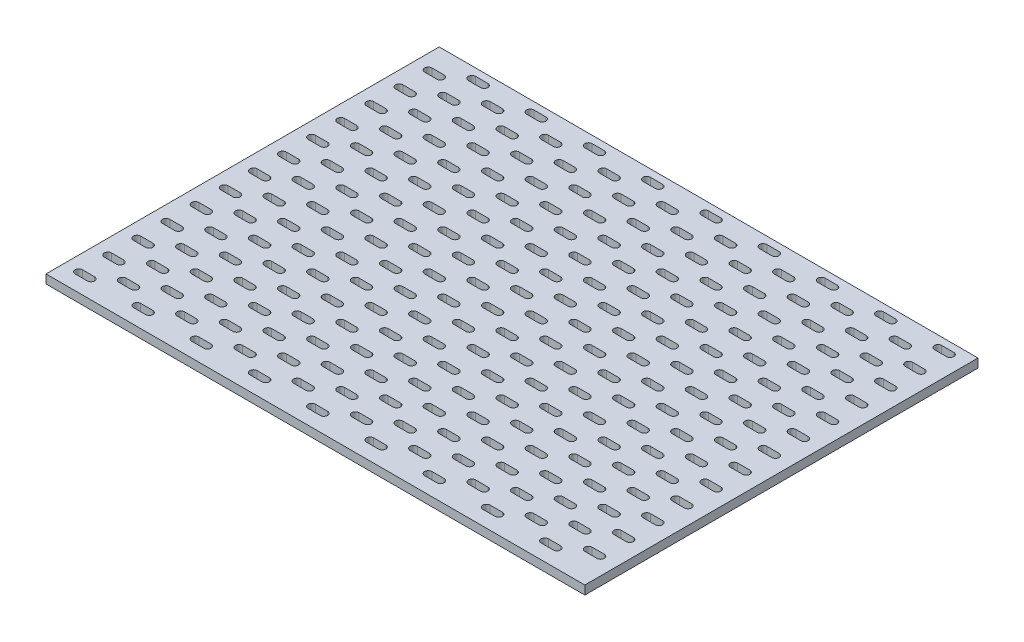
from build123d import *

# Parameters (mm, degrees)
SKETCH_1_W      = 370
SKETCH_1_H      = 270
EXTRUDE_1_DEPTH = 6


with BuildPart() as part:
    # Эскиз1 → Бобышка-Вытянуть1 (new body)
    with BuildSketch(Plane(origin=(0, 0, 0), x_dir=(1, 0, 0), z_dir=(0, 1, 0))):
        Rectangle(SKETCH_1_W, SKETCH_1_H)
        with BuildLine():
            Line((-155, 130), (-146.632466568, 130))
            ThreePointArc((-146.632466568, 130), (-144.132466568, 127.5), (-146.632466568, 125))
            Line((-146.632466568, 125), (-155, 125))
            ThreePointArc((-155, 125), (-157.5, 127.5), (-155, 130))
        make_face(mode=Mode.SUBTRACT)
        with BuildLine():
            Line((-175, 115), (-166.632466568, 115))
            ThreePointArc((-166.632466568, 115), (-164.132466568, 117.5), (-166.632466568, 120))
            Line((-166.632466568, 120), (-175, 120))
            ThreePointArc((-175, 120), (-177.5, 117.5), (-175, 115))
        make_face(mode=Mode.SUBTRACT)
        with BuildLine():
            Line((-115, 130), (-106.632466568, 130))
            ThreePointArc((-106.632466568, 130), (-104.132466568, 127.5), (-106.632466568, 125))
            Line((-106.632466568, 125), (-115, 125))
            ThreePointArc((-115, 125), (-117.5, 127.5), (-115, 130))
        make_face(mode=Mode.SUBTRACT)
        with BuildLine():
            Line((-135, 115), (-126.632466568, 115))
            ThreePointArc((-126.632466568, 115), (-124.132466568, 117.5), (-126.632466568, 120))
            Line((-126.632466568, 120), (-135, 120))
            ThreePointArc((-135, 120), (-137.5, 117.5), (-135, 115))
        make_face(mode=Mode.SUBTRACT)
        with BuildLine():
            Line((-75, 130), (-66.632466568, 130))
            ThreePointArc((-66.632466568, 130), (-64.132466568, 127.5), (-66.632466568, 125))
            Line((-66.632466568, 125), (-75, 125))
            ThreePointArc((-75, 125), (-77.5, 127.5), (-75, 130))
        make_face(mode=Mode.SUBTRACT)
        with BuildLine():
            Line((-95, 115), (-86.632466568, 115))
            ThreePointArc((-86.632466568, 115), (-84.132466568, 117.5), (-86.632466568, 120))
            Line((-86.632466568, 120), (-95, 120))
            ThreePointArc((-95, 120), (-97.5, 117.5), (-95, 115))
        make_face(mode=Mode.SUBTRACT)
        with BuildLine():
            Line((-35, 130), (-26.632466568, 130))
            ThreePointArc((-26.632466568, 130), (-24.132466568, 127.5), (-26.632466568, 125))
            Line((-26.632466568, 125), (-35, 125))
            ThreePointArc((-35, 125), (-37.5, 127.5), (-35, 130))
        make_face(mode=Mode.SUBTRACT)
        with BuildLine():
            Line((-55, 115), (-46.632466568, 115))
            ThreePointArc((-46.632466568, 115), (-44.132466568, 117.5), (-46.632466568, 120))
            Line((-46.632466568, 120), (-55, 120))
            ThreePointArc((-55, 120), (-57.5, 117.5), (-55, 115))
        make_face(mode=Mode.SUBTRACT)
        with BuildLine():
            Line((5, 130), (13.367533432, 130))
            ThreePointArc((13.367533432, 130), (15.867533432, 127.5), (13.367533432, 125))
            Line((13.367533432, 125), (5, 125))
            ThreePointArc((5, 125), (2.5, 127.5), (5, 130))
        make_face(mode=Mode.SUBTRACT)
        with BuildLine():
            Line((-15, 115), (-6.632466568, 115))
            ThreePointArc((-6.632466568, 115), (-4.132466568, 117.5), (-6.632466568, 120))
            Line((-6.632466568, 120), (-15, 120))
            ThreePointArc((-15, 120), (-17.5, 117.5), (-15, 115))
        make_face(mode=Mode.SUBTRACT)
        with BuildLine():
            Line((45, 130), (53.367533432, 130))
            ThreePointArc((53.367533432, 130), (55.867533432, 127.5), (53.367533432, 125))
            Line((53.367533432, 125), (45, 125))
            ThreePointArc((45, 125), (42.5, 127.5), (45, 130))
        make_face(mode=Mode.SUBTRACT)
        with BuildLine():
            Line((25, 115), (33.367533432, 115))
            ThreePointArc((33.367533432, 115), (35.867533432, 117.5), (33.367533432, 120))
            Line((33.367533432, 120), (25, 120))
            ThreePointArc((25, 120), (22.5, 117.5), (25, 115))
        make_face(mode=Mode.SUBTRACT)
        with BuildLine():
            Line((85, 130), (93.367533432, 130))
            ThreePointArc((93.367533432, 130), (95.867533432, 127.5), (93.367533432, 125))
            Line((93.367533432, 125), (85, 125))
            ThreePointArc((85, 125), (82.5, 127.5), (85, 130))
        make_face(mode=Mode.SUBTRACT)
        with BuildLine():
            Line((65, 115), (73.367533432, 115))
            ThreePointArc((73.367533432, 115), (75.867533432, 117.5), (73.367533432, 120))
            Line((73.367533432, 120), (65, 120))
            ThreePointArc((65, 120), (62.5, 117.5), (65, 115))
        make_face(mode=Mode.SUBTRACT)
        with BuildLine():
            Line((125, 130), (133.367533432, 130))
            ThreePointArc((133.367533432, 130), (135.867533432, 127.5), (133.367533432, 125))
            Line((133.367533432, 125), (125, 125))
            ThreePointArc((125, 125), (122.5, 127.5), (125, 130))
        make_face(mode=Mode.SUBTRACT)
        with BuildLine():
            Line((105, 115), (113.367533432, 115))
            ThreePointArc((113.367533432, 115), (115.867533432, 117.5), (113.367533432, 120))
            Line((113.367533432, 120), (105, 120))
            ThreePointArc((105, 120), (102.5, 117.5), (105, 115))
        make_face(mode=Mode.SUBTRACT)
        with BuildLine():
            Line((165, 130), (173.367533432, 130))
            ThreePointArc((173.367533432, 130), (175.867533432, 127.5), (173.367533432, 125))
            Line((173.367533432, 125), (165, 125))
            ThreePointArc((165, 125), (162.5, 127.5), (165, 130))
        make_face(mode=Mode.SUBTRACT)
        with BuildLine():
            Line((145, 115), (153.367533432, 115))
            ThreePointArc((153.367533432, 115), (155.867533432, 117.5), (153.367533432, 120))
            Line((153.367533432, 120), (145, 120))
            ThreePointArc((145, 120), (142.5, 117.5), (145, 115))
        make_face(mode=Mode.SUBTRACT)
        with BuildLine():
            Line((-155, 110), (-146.632466568, 110))
            ThreePointArc((-146.632466568, 110), (-144.132466568, 107.5), (-146.632466568, 105))
            Line((-146.632466568, 105), (-155, 105))
            ThreePointArc((-155, 105), (-157.5, 107.5), (-155, 110))
        make_face(mode=Mode.SUBTRACT)
        with BuildLine():
            Line((-175, 95), (-166.632466568, 95))
            ThreePointArc((-166.632466568, 95), (-164.132466568, 97.5), (-166.632466568, 100))
            Line((-166.632466568, 100), (-175, 100))
            ThreePointArc((-175, 100), (-177.5, 97.5), (-175, 95))
        make_face(mode=Mode.SUBTRACT)
        with BuildLine():
            Line((-115, 110), (-106.632466568, 110))
            ThreePointArc((-106.632466568, 110), (-104.132466568, 107.5), (-106.632466568, 105))
            Line((-106.632466568, 105), (-115, 105))
            ThreePointArc((-115, 105), (-117.5, 107.5), (-115, 110))
        make_face(mode=Mode.SUBTRACT)
        with BuildLine():
            Line((-135, 95), (-126.632466568, 95))
            ThreePointArc((-126.632466568, 95), (-124.132466568, 97.5), (-126.632466568, 100))
            Line((-126.632466568, 100), (-135, 100))
            ThreePointArc((-135, 100), (-137.5, 97.5), (-135, 95))
        make_face(mode=Mode.SUBTRACT)
        with BuildLine():
            Line((-75, 110), (-66.632466568, 110))
            ThreePointArc((-66.632466568, 110), (-64.132466568, 107.5), (-66.632466568, 105))
            Line((-66.632466568, 105), (-75, 105))
            ThreePointArc((-75, 105), (-77.5, 107.5), (-75, 110))
        make_face(mode=Mode.SUBTRACT)
        with BuildLine():
            Line((-95, 95), (-86.632466568, 95))
            ThreePointArc((-86.632466568, 95), (-84.132466568, 97.5), (-86.632466568, 100))
            Line((-86.632466568, 100), (-95, 100))
            ThreePointArc((-95, 100), (-97.5, 97.5), (-95, 95))
        make_face(mode=Mode.SUBTRACT)
        with BuildLine():
            Line((-35, 110), (-26.632466568, 110))
            ThreePointArc((-26.632466568, 110), (-24.132466568, 107.5), (-26.632466568, 105))
            Line((-26.632466568, 105), (-35, 105))
            ThreePointArc((-35, 105), (-37.5, 107.5), (-35, 110))
        make_face(mode=Mode.SUBTRACT)
        with BuildLine():
            Line((-55, 95), (-46.632466568, 95))
            ThreePointArc((-46.632466568, 95), (-44.132466568, 97.5), (-46.632466568, 100))
            Line((-46.632466568, 100), (-55, 100))
            ThreePointArc((-55, 100), (-57.5, 97.5), (-55, 95))
        make_face(mode=Mode.SUBTRACT)
        with BuildLine():
            Line((5, 110), (13.367533432, 110))
            ThreePointArc((13.367533432, 110), (15.867533432, 107.5), (13.367533432, 105))
            Line((13.367533432, 105), (5, 105))
            ThreePointArc((5, 105), (2.5, 107.5), (5, 110))
        make_face(mode=Mode.SUBTRACT)
        with BuildLine():
            Line((-15, 95), (-6.632466568, 95))
            ThreePointArc((-6.632466568, 95), (-4.132466568, 97.5), (-6.632466568, 100))
            Line((-6.632466568, 100), (-15, 100))
            ThreePointArc((-15, 100), (-17.5, 97.5), (-15, 95))
        make_face(mode=Mode.SUBTRACT)
        with BuildLine():
            Line((45, 110), (53.367533432, 110))
            ThreePointArc((53.367533432, 110), (55.867533432, 107.5), (53.367533432, 105))
            Line((53.367533432, 105), (45, 105))
            ThreePointArc((45, 105), (42.5, 107.5), (45, 110))
        make_face(mode=Mode.SUBTRACT)
        with BuildLine():
            Line((25, 95), (33.367533432, 95))
            ThreePointArc((33.367533432, 95), (35.867533432, 97.5), (33.367533432, 100))
            Line((33.367533432, 100), (25, 100))
            ThreePointArc((25, 100), (22.5, 97.5), (25, 95))
        make_face(mode=Mode.SUBTRACT)
        with BuildLine():
            Line((85, 110), (93.367533432, 110))
            ThreePointArc((93.367533432, 110), (95.867533432, 107.5), (93.367533432, 105))
            Line((93.367533432, 105), (85, 105))
            ThreePointArc((85, 105), (82.5, 107.5), (85, 110))
        make_face(mode=Mode.SUBTRACT)
        with BuildLine():
            Line((65, 95), (73.367533432, 95))
            ThreePointArc((73.367533432, 95), (75.867533432, 97.5), (73.367533432, 100))
            Line((73.367533432, 100), (65, 100))
            ThreePointArc((65, 100), (62.5, 97.5), (65, 95))
        make_face(mode=Mode.SUBTRACT)
        with BuildLine():
            Line((125, 110), (133.367533432, 110))
            ThreePointArc((133.367533432, 110), (135.867533432, 107.5), (133.367533432, 105))
            Line((133.367533432, 105), (125, 105))
            ThreePointArc((125, 105), (122.5, 107.5), (125, 110))
        make_face(mode=Mode.SUBTRACT)
        with BuildLine():
            Line((105, 95), (113.367533432, 95))
            ThreePointArc((113.367533432, 95), (115.867533432, 97.5), (113.367533432, 100))
            Line((113.367533432, 100), (105, 100))
            ThreePointArc((105, 100), (102.5, 97.5), (105, 95))
        make_face(mode=Mode.SUBTRACT)
        with BuildLine():
            Line((165, 110), (173.367533432, 110))
            ThreePointArc((173.367533432, 110), (175.867533432, 107.5), (173.367533432, 105))
            Line((173.367533432, 105), (165, 105))
            ThreePointArc((165, 105), (162.5, 107.5), (165, 110))
        make_face(mode=Mode.SUBTRACT)
        with BuildLine():
            Line((145, 95), (153.367533432, 95))
            ThreePointArc((153.367533432, 95), (155.867533432, 97.5), (153.367533432, 100))
            Line((153.367533432, 100), (145, 100))
            ThreePointArc((145, 100), (142.5, 97.5), (145, 95))
        make_face(mode=Mode.SUBTRACT)
        with BuildLine():
            Line((-155, 90), (-146.632466568, 90))
            ThreePointArc((-146.632466568, 90), (-144.132466568, 87.5), (-146.632466568, 85))
            Line((-146.632466568, 85), (-155, 85))
            ThreePointArc((-155, 85), (-157.5, 87.5), (-155, 90))
        make_face(mode=Mode.SUBTRACT)
        with BuildLine():
            Line((-175, 75), (-166.632466568, 75))
            ThreePointArc((-166.632466568, 75), (-164.132466568, 77.5), (-166.632466568, 80))
            Line((-166.632466568, 80), (-175, 80))
            ThreePointArc((-175, 80), (-177.5, 77.5), (-175, 75))
        make_face(mode=Mode.SUBTRACT)
        with BuildLine():
            Line((-115, 90), (-106.632466568, 90))
            ThreePointArc((-106.632466568, 90), (-104.132466568, 87.5), (-106.632466568, 85))
            Line((-106.632466568, 85), (-115, 85))
            ThreePointArc((-115, 85), (-117.5, 87.5), (-115, 90))
        make_face(mode=Mode.SUBTRACT)
        with BuildLine():
            Line((-135, 75), (-126.632466568, 75))
            ThreePointArc((-126.632466568, 75), (-124.132466568, 77.5), (-126.632466568, 80))
            Line((-126.632466568, 80), (-135, 80))
            ThreePointArc((-135, 80), (-137.5, 77.5), (-135, 75))
        make_face(mode=Mode.SUBTRACT)
        with BuildLine():
            Line((-75, 90), (-66.632466568, 90))
            ThreePointArc((-66.632466568, 90), (-64.132466568, 87.5), (-66.632466568, 85))
            Line((-66.632466568, 85), (-75, 85))
            ThreePointArc((-75, 85), (-77.5, 87.5), (-75, 90))
        make_face(mode=Mode.SUBTRACT)
        with BuildLine():
            Line((-95, 75), (-86.632466568, 75))
            ThreePointArc((-86.632466568, 75), (-84.132466568, 77.5), (-86.632466568, 80))
            Line((-86.632466568, 80), (-95, 80))
            ThreePointArc((-95, 80), (-97.5, 77.5), (-95, 75))
        make_face(mode=Mode.SUBTRACT)
        with BuildLine():
            Line((-35, 90), (-26.632466568, 90))
            ThreePointArc((-26.632466568, 90), (-24.132466568, 87.5), (-26.632466568, 85))
            Line((-26.632466568, 85), (-35, 85))
            ThreePointArc((-35, 85), (-37.5, 87.5), (-35, 90))
        make_face(mode=Mode.SUBTRACT)
        with BuildLine():
            Line((-55, 75), (-46.632466568, 75))
            ThreePointArc((-46.632466568, 75), (-44.132466568, 77.5), (-46.632466568, 80))
            Line((-46.632466568, 80), (-55, 80))
            ThreePointArc((-55, 80), (-57.5, 77.5), (-55, 75))
        make_face(mode=Mode.SUBTRACT)
        with BuildLine():
            Line((5, 90), (13.367533432, 90))
            ThreePointArc((13.367533432, 90), (15.867533432, 87.5), (13.367533432, 85))
            Line((13.367533432, 85), (5, 85))
            ThreePointArc((5, 85), (2.5, 87.5), (5, 90))
        make_face(mode=Mode.SUBTRACT)
        with BuildLine():
            Line((-15, 75), (-6.632466568, 75))
            ThreePointArc((-6.632466568, 75), (-4.132466568, 77.5), (-6.632466568, 80))
            Line((-6.632466568, 80), (-15, 80))
            ThreePointArc((-15, 80), (-17.5, 77.5), (-15, 75))
        make_face(mode=Mode.SUBTRACT)
        with BuildLine():
            Line((45, 90), (53.367533432, 90))
            ThreePointArc((53.367533432, 90), (55.867533432, 87.5), (53.367533432, 85))
            Line((53.367533432, 85), (45, 85))
            ThreePointArc((45, 85), (42.5, 87.5), (45, 90))
        make_face(mode=Mode.SUBTRACT)
        with BuildLine():
            Line((25, 75), (33.367533432, 75))
            ThreePointArc((33.367533432, 75), (35.867533432, 77.5), (33.367533432, 80))
            Line((33.367533432, 80), (25, 80))
            ThreePointArc((25, 80), (22.5, 77.5), (25, 75))
        make_face(mode=Mode.SUBTRACT)
        with BuildLine():
            Line((85, 90), (93.367533432, 90))
            ThreePointArc((93.367533432, 90), (95.867533432, 87.5), (93.367533432, 85))
            Line((93.367533432, 85), (85, 85))
            ThreePointArc((85, 85), (82.5, 87.5), (85, 90))
        make_face(mode=Mode.SUBTRACT)
        with BuildLine():
            Line((65, 75), (73.367533432, 75))
            ThreePointArc((73.367533432, 75), (75.867533432, 77.5), (73.367533432, 80))
            Line((73.367533432, 80), (65, 80))
            ThreePointArc((65, 80), (62.5, 77.5), (65, 75))
        make_face(mode=Mode.SUBTRACT)
        with BuildLine():
            Line((125, 90), (133.367533432, 90))
            ThreePointArc((133.367533432, 90), (135.867533432, 87.5), (133.367533432, 85))
            Line((133.367533432, 85), (125, 85))
            ThreePointArc((125, 85), (122.5, 87.5), (125, 90))
        make_face(mode=Mode.SUBTRACT)
        with BuildLine():
            Line((105, 75), (113.367533432, 75))
            ThreePointArc((113.367533432, 75), (115.867533432, 77.5), (113.367533432, 80))
            Line((113.367533432, 80), (105, 80))
            ThreePointArc((105, 80), (102.5, 77.5), (105, 75))
        make_face(mode=Mode.SUBTRACT)
        with BuildLine():
            Line((165, 90), (173.367533432, 90))
            ThreePointArc((173.367533432, 90), (175.867533432, 87.5), (173.367533432, 85))
            Line((173.367533432, 85), (165, 85))
            ThreePointArc((165, 85), (162.5, 87.5), (165, 90))
        make_face(mode=Mode.SUBTRACT)
        with BuildLine():
            Line((145, 75), (153.367533432, 75))
            ThreePointArc((153.367533432, 75), (155.867533432, 77.5), (153.367533432, 80))
            Line((153.367533432, 80), (145, 80))
            ThreePointArc((145, 80), (142.5, 77.5), (145, 75))
        make_face(mode=Mode.SUBTRACT)
        with BuildLine():
            Line((-155, 70), (-146.632466568, 70))
            ThreePointArc((-146.632466568, 70), (-144.132466568, 67.5), (-146.632466568, 65))
            Line((-146.632466568, 65), (-155, 65))
            ThreePointArc((-155, 65), (-157.5, 67.5), (-155, 70))
        make_face(mode=Mode.SUBTRACT)
        with BuildLine():
            Line((-175, 55), (-166.632466568, 55))
            ThreePointArc((-166.632466568, 55), (-164.132466568, 57.5), (-166.632466568, 60))
            Line((-166.632466568, 60), (-175, 60))
            ThreePointArc((-175, 60), (-177.5, 57.5), (-175, 55))
        make_face(mode=Mode.SUBTRACT)
        with BuildLine():
            Line((-115, 70), (-106.632466568, 70))
            ThreePointArc((-106.632466568, 70), (-104.132466568, 67.5), (-106.632466568, 65))
            Line((-106.632466568, 65), (-115, 65))
            ThreePointArc((-115, 65), (-117.5, 67.5), (-115, 70))
        make_face(mode=Mode.SUBTRACT)
        with BuildLine():
            Line((-135, 55), (-126.632466568, 55))
            ThreePointArc((-126.632466568, 55), (-124.132466568, 57.5), (-126.632466568, 60))
            Line((-126.632466568, 60), (-135, 60))
            ThreePointArc((-135, 60), (-137.5, 57.5), (-135, 55))
        make_face(mode=Mode.SUBTRACT)
        with BuildLine():
            Line((-75, 70), (-66.632466568, 70))
            ThreePointArc((-66.632466568, 70), (-64.132466568, 67.5), (-66.632466568, 65))
            Line((-66.632466568, 65), (-75, 65))
            ThreePointArc((-75, 65), (-77.5, 67.5), (-75, 70))
        make_face(mode=Mode.SUBTRACT)
        with BuildLine():
            Line((-95, 55), (-86.632466568, 55))
            ThreePointArc((-86.632466568, 55), (-84.132466568, 57.5), (-86.632466568, 60))
            Line((-86.632466568, 60), (-95, 60))
            ThreePointArc((-95, 60), (-97.5, 57.5), (-95, 55))
        make_face(mode=Mode.SUBTRACT)
        with BuildLine():
            Line((-35, 70), (-26.632466568, 70))
            ThreePointArc((-26.632466568, 70), (-24.132466568, 67.5), (-26.632466568, 65))
            Line((-26.632466568, 65), (-35, 65))
            ThreePointArc((-35, 65), (-37.5, 67.5), (-35, 70))
        make_face(mode=Mode.SUBTRACT)
        with BuildLine():
            Line((-55, 55), (-46.632466568, 55))
            ThreePointArc((-46.632466568, 55), (-44.132466568, 57.5), (-46.632466568, 60))
            Line((-46.632466568, 60), (-55, 60))
            ThreePointArc((-55, 60), (-57.5, 57.5), (-55, 55))
        make_face(mode=Mode.SUBTRACT)
        with BuildLine():
            Line((5, 70), (13.367533432, 70))
            ThreePointArc((13.367533432, 70), (15.867533432, 67.5), (13.367533432, 65))
            Line((13.367533432, 65), (5, 65))
            ThreePointArc((5, 65), (2.5, 67.5), (5, 70))
        make_face(mode=Mode.SUBTRACT)
        with BuildLine():
            Line((-15, 55), (-6.632466568, 55))
            ThreePointArc((-6.632466568, 55), (-4.132466568, 57.5), (-6.632466568, 60))
            Line((-6.632466568, 60), (-15, 60))
            ThreePointArc((-15, 60), (-17.5, 57.5), (-15, 55))
        make_face(mode=Mode.SUBTRACT)
        with BuildLine():
            Line((45, 70), (53.367533432, 70))
            ThreePointArc((53.367533432, 70), (55.867533432, 67.5), (53.367533432, 65))
            Line((53.367533432, 65), (45, 65))
            ThreePointArc((45, 65), (42.5, 67.5), (45, 70))
        make_face(mode=Mode.SUBTRACT)
        with BuildLine():
            Line((25, 55), (33.367533432, 55))
            ThreePointArc((33.367533432, 55), (35.867533432, 57.5), (33.367533432, 60))
            Line((33.367533432, 60), (25, 60))
            ThreePointArc((25, 60), (22.5, 57.5), (25, 55))
        make_face(mode=Mode.SUBTRACT)
        with BuildLine():
            Line((85, 70), (93.367533432, 70))
            ThreePointArc((93.367533432, 70), (95.867533432, 67.5), (93.367533432, 65))
            Line((93.367533432, 65), (85, 65))
            ThreePointArc((85, 65), (82.5, 67.5), (85, 70))
        make_face(mode=Mode.SUBTRACT)
        with BuildLine():
            Line((65, 55), (73.367533432, 55))
            ThreePointArc((73.367533432, 55), (75.867533432, 57.5), (73.367533432, 60))
            Line((73.367533432, 60), (65, 60))
            ThreePointArc((65, 60), (62.5, 57.5), (65, 55))
        make_face(mode=Mode.SUBTRACT)
        with BuildLine():
            Line((125, 70), (133.367533432, 70))
            ThreePointArc((133.367533432, 70), (135.867533432, 67.5), (133.367533432, 65))
            Line((133.367533432, 65), (125, 65))
            ThreePointArc((125, 65), (122.5, 67.5), (125, 70))
        make_face(mode=Mode.SUBTRACT)
        with BuildLine():
            Line((105, 55), (113.367533432, 55))
            ThreePointArc((113.367533432, 55), (115.867533432, 57.5), (113.367533432, 60))
            Line((113.367533432, 60), (105, 60))
            ThreePointArc((105, 60), (102.5, 57.5), (105, 55))
        make_face(mode=Mode.SUBTRACT)
        with BuildLine():
            Line((165, 70), (173.367533432, 70))
            ThreePointArc((173.367533432, 70), (175.867533432, 67.5), (173.367533432, 65))
            Line((173.367533432, 65), (165, 65))
            ThreePointArc((165, 65), (162.5, 67.5), (165, 70))
        make_face(mode=Mode.SUBTRACT)
        with BuildLine():
            Line((145, 55), (153.367533432, 55))
            ThreePointArc((153.367533432, 55), (155.867533432, 57.5), (153.367533432, 60))
            Line((153.367533432, 60), (145, 60))
            ThreePointArc((145, 60), (142.5, 57.5), (145, 55))
        make_face(mode=Mode.SUBTRACT)
        with BuildLine():
            Line((-155, 50), (-146.632466568, 50))
            ThreePointArc((-146.632466568, 50), (-144.132466568, 47.5), (-146.632466568, 45))
            Line((-146.632466568, 45), (-155, 45))
            ThreePointArc((-155, 45), (-157.5, 47.5), (-155, 50))
        make_face(mode=Mode.SUBTRACT)
        with BuildLine():
            Line((-175, 35), (-166.632466568, 35))
            ThreePointArc((-166.632466568, 35), (-164.132466568, 37.5), (-166.632466568, 40))
            Line((-166.632466568, 40), (-175, 40))
            ThreePointArc((-175, 40), (-177.5, 37.5), (-175, 35))
        make_face(mode=Mode.SUBTRACT)
        with BuildLine():
            Line((-115, 50), (-106.632466568, 50))
            ThreePointArc((-106.632466568, 50), (-104.132466568, 47.5), (-106.632466568, 45))
            Line((-106.632466568, 45), (-115, 45))
            ThreePointArc((-115, 45), (-117.5, 47.5), (-115, 50))
        make_face(mode=Mode.SUBTRACT)
        with BuildLine():
            Line((-135, 35), (-126.632466568, 35))
            ThreePointArc((-126.632466568, 35), (-124.132466568, 37.5), (-126.632466568, 40))
            Line((-126.632466568, 40), (-135, 40))
            ThreePointArc((-135, 40), (-137.5, 37.5), (-135, 35))
        make_face(mode=Mode.SUBTRACT)
        with BuildLine():
            Line((-75, 50), (-66.632466568, 50))
            ThreePointArc((-66.632466568, 50), (-64.132466568, 47.5), (-66.632466568, 45))
            Line((-66.632466568, 45), (-75, 45))
            ThreePointArc((-75, 45), (-77.5, 47.5), (-75, 50))
        make_face(mode=Mode.SUBTRACT)
        with BuildLine():
            Line((-95, 35), (-86.632466568, 35))
            ThreePointArc((-86.632466568, 35), (-84.132466568, 37.5), (-86.632466568, 40))
            Line((-86.632466568, 40), (-95, 40))
            ThreePointArc((-95, 40), (-97.5, 37.5), (-95, 35))
        make_face(mode=Mode.SUBTRACT)
        with BuildLine():
            Line((-35, 50), (-26.632466568, 50))
            ThreePointArc((-26.632466568, 50), (-24.132466568, 47.5), (-26.632466568, 45))
            Line((-26.632466568, 45), (-35, 45))
            ThreePointArc((-35, 45), (-37.5, 47.5), (-35, 50))
        make_face(mode=Mode.SUBTRACT)
        with BuildLine():
            Line((-55, 35), (-46.632466568, 35))
            ThreePointArc((-46.632466568, 35), (-44.132466568, 37.5), (-46.632466568, 40))
            Line((-46.632466568, 40), (-55, 40))
            ThreePointArc((-55, 40), (-57.5, 37.5), (-55, 35))
        make_face(mode=Mode.SUBTRACT)
        with BuildLine():
            Line((5, 50), (13.367533432, 50))
            ThreePointArc((13.367533432, 50), (15.867533432, 47.5), (13.367533432, 45))
            Line((13.367533432, 45), (5, 45))
            ThreePointArc((5, 45), (2.5, 47.5), (5, 50))
        make_face(mode=Mode.SUBTRACT)
        with BuildLine():
            Line((-15, 35), (-6.632466568, 35))
            ThreePointArc((-6.632466568, 35), (-4.132466568, 37.5), (-6.632466568, 40))
            Line((-6.632466568, 40), (-15, 40))
            ThreePointArc((-15, 40), (-17.5, 37.5), (-15, 35))
        make_face(mode=Mode.SUBTRACT)
        with BuildLine():
            Line((45, 50), (53.367533432, 50))
            ThreePointArc((53.367533432, 50), (55.867533432, 47.5), (53.367533432, 45))
            Line((53.367533432, 45), (45, 45))
            ThreePointArc((45, 45), (42.5, 47.5), (45, 50))
        make_face(mode=Mode.SUBTRACT)
        with BuildLine():
            Line((25, 35), (33.367533432, 35))
            ThreePointArc((33.367533432, 35), (35.867533432, 37.5), (33.367533432, 40))
            Line((33.367533432, 40), (25, 40))
            ThreePointArc((25, 40), (22.5, 37.5), (25, 35))
        make_face(mode=Mode.SUBTRACT)
        with BuildLine():
            Line((85, 50), (93.367533432, 50))
            ThreePointArc((93.367533432, 50), (95.867533432, 47.5), (93.367533432, 45))
            Line((93.367533432, 45), (85, 45))
            ThreePointArc((85, 45), (82.5, 47.5), (85, 50))
        make_face(mode=Mode.SUBTRACT)
        with BuildLine():
            Line((65, 35), (73.367533432, 35))
            ThreePointArc((73.367533432, 35), (75.867533432, 37.5), (73.367533432, 40))
            Line((73.367533432, 40), (65, 40))
            ThreePointArc((65, 40), (62.5, 37.5), (65, 35))
        make_face(mode=Mode.SUBTRACT)
        with BuildLine():
            Line((125, 50), (133.367533432, 50))
            ThreePointArc((133.367533432, 50), (135.867533432, 47.5), (133.367533432, 45))
            Line((133.367533432, 45), (125, 45))
            ThreePointArc((125, 45), (122.5, 47.5), (125, 50))
        make_face(mode=Mode.SUBTRACT)
        with BuildLine():
            Line((105, 35), (113.367533432, 35))
            ThreePointArc((113.367533432, 35), (115.867533432, 37.5), (113.367533432, 40))
            Line((113.367533432, 40), (105, 40))
            ThreePointArc((105, 40), (102.5, 37.5), (105, 35))
        make_face(mode=Mode.SUBTRACT)
        with BuildLine():
            Line((165, 50), (173.367533432, 50))
            ThreePointArc((173.367533432, 50), (175.867533432, 47.5), (173.367533432, 45))
            Line((173.367533432, 45), (165, 45))
            ThreePointArc((165, 45), (162.5, 47.5), (165, 50))
        make_face(mode=Mode.SUBTRACT)
        with BuildLine():
            Line((145, 35), (153.367533432, 35))
            ThreePointArc((153.367533432, 35), (155.867533432, 37.5), (153.367533432, 40))
            Line((153.367533432, 40), (145, 40))
            ThreePointArc((145, 40), (142.5, 37.5), (145, 35))
        make_face(mode=Mode.SUBTRACT)
        with BuildLine():
            Line((-155, 30), (-146.632466568, 30))
            ThreePointArc((-146.632466568, 30), (-144.132466568, 27.5), (-146.632466568, 25))
            Line((-146.632466568, 25), (-155, 25))
            ThreePointArc((-155, 25), (-157.5, 27.5), (-155, 30))
        make_face(mode=Mode.SUBTRACT)
        with BuildLine():
            Line((-175, 15), (-166.632466568, 15))
            ThreePointArc((-166.632466568, 15), (-164.132466568, 17.5), (-166.632466568, 20))
            Line((-166.632466568, 20), (-175, 20))
            ThreePointArc((-175, 20), (-177.5, 17.5), (-175, 15))
        make_face(mode=Mode.SUBTRACT)
        with BuildLine():
            Line((-115, 30), (-106.632466568, 30))
            ThreePointArc((-106.632466568, 30), (-104.132466568, 27.5), (-106.632466568, 25))
            Line((-106.632466568, 25), (-115, 25))
            ThreePointArc((-115, 25), (-117.5, 27.5), (-115, 30))
        make_face(mode=Mode.SUBTRACT)
        with BuildLine():
            Line((-135, 15), (-126.632466568, 15))
            ThreePointArc((-126.632466568, 15), (-124.132466568, 17.5), (-126.632466568, 20))
            Line((-126.632466568, 20), (-135, 20))
            ThreePointArc((-135, 20), (-137.5, 17.5), (-135, 15))
        make_face(mode=Mode.SUBTRACT)
        with BuildLine():
            Line((-75, 30), (-66.632466568, 30))
            ThreePointArc((-66.632466568, 30), (-64.132466568, 27.5), (-66.632466568, 25))
            Line((-66.632466568, 25), (-75, 25))
            ThreePointArc((-75, 25), (-77.5, 27.5), (-75, 30))
        make_face(mode=Mode.SUBTRACT)
        with BuildLine():
            Line((-95, 15), (-86.632466568, 15))
            ThreePointArc((-86.632466568, 15), (-84.132466568, 17.5), (-86.632466568, 20))
            Line((-86.632466568, 20), (-95, 20))
            ThreePointArc((-95, 20), (-97.5, 17.5), (-95, 15))
        make_face(mode=Mode.SUBTRACT)
        with BuildLine():
            Line((-35, 30), (-26.632466568, 30))
            ThreePointArc((-26.632466568, 30), (-24.132466568, 27.5), (-26.632466568, 25))
            Line((-26.632466568, 25), (-35, 25))
            ThreePointArc((-35, 25), (-37.5, 27.5), (-35, 30))
        make_face(mode=Mode.SUBTRACT)
        with BuildLine():
            Line((-55, 15), (-46.632466568, 15))
            ThreePointArc((-46.632466568, 15), (-44.132466568, 17.5), (-46.632466568, 20))
            Line((-46.632466568, 20), (-55, 20))
            ThreePointArc((-55, 20), (-57.5, 17.5), (-55, 15))
        make_face(mode=Mode.SUBTRACT)
        with BuildLine():
            Line((5, 30), (13.367533432, 30))
            ThreePointArc((13.367533432, 30), (15.867533432, 27.5), (13.367533432, 25))
            Line((13.367533432, 25), (5, 25))
            ThreePointArc((5, 25), (2.5, 27.5), (5, 30))
        make_face(mode=Mode.SUBTRACT)
        with BuildLine():
            Line((-15, 15), (-6.632466568, 15))
            ThreePointArc((-6.632466568, 15), (-4.132466568, 17.5), (-6.632466568, 20))
            Line((-6.632466568, 20), (-15, 20))
            ThreePointArc((-15, 20), (-17.5, 17.5), (-15, 15))
        make_face(mode=Mode.SUBTRACT)
        with BuildLine():
            Line((45, 30), (53.367533432, 30))
            ThreePointArc((53.367533432, 30), (55.867533432, 27.5), (53.367533432, 25))
            Line((53.367533432, 25), (45, 25))
            ThreePointArc((45, 25), (42.5, 27.5), (45, 30))
        make_face(mode=Mode.SUBTRACT)
        with BuildLine():
            Line((25, 15), (33.367533432, 15))
            ThreePointArc((33.367533432, 15), (35.867533432, 17.5), (33.367533432, 20))
            Line((33.367533432, 20), (25, 20))
            ThreePointArc((25, 20), (22.5, 17.5), (25, 15))
        make_face(mode=Mode.SUBTRACT)
        with BuildLine():
            Line((85, 30), (93.367533432, 30))
            ThreePointArc((93.367533432, 30), (95.867533432, 27.5), (93.367533432, 25))
            Line((93.367533432, 25), (85, 25))
            ThreePointArc((85, 25), (82.5, 27.5), (85, 30))
        make_face(mode=Mode.SUBTRACT)
        with BuildLine():
            Line((65, 15), (73.367533432, 15))
            ThreePointArc((73.367533432, 15), (75.867533432, 17.5), (73.367533432, 20))
            Line((73.367533432, 20), (65, 20))
            ThreePointArc((65, 20), (62.5, 17.5), (65, 15))
        make_face(mode=Mode.SUBTRACT)
        with BuildLine():
            Line((125, 30), (133.367533432, 30))
            ThreePointArc((133.367533432, 30), (135.867533432, 27.5), (133.367533432, 25))
            Line((133.367533432, 25), (125, 25))
            ThreePointArc((125, 25), (122.5, 27.5), (125, 30))
        make_face(mode=Mode.SUBTRACT)
        with BuildLine():
            Line((105, 15), (113.367533432, 15))
            ThreePointArc((113.367533432, 15), (115.867533432, 17.5), (113.367533432, 20))
            Line((113.367533432, 20), (105, 20))
            ThreePointArc((105, 20), (102.5, 17.5), (105, 15))
        make_face(mode=Mode.SUBTRACT)
        with BuildLine():
            Line((165, 30), (173.367533432, 30))
            ThreePointArc((173.367533432, 30), (175.867533432, 27.5), (173.367533432, 25))
            Line((173.367533432, 25), (165, 25))
            ThreePointArc((165, 25), (162.5, 27.5), (165, 30))
        make_face(mode=Mode.SUBTRACT)
        with BuildLine():
            Line((145, 15), (153.367533432, 15))
            ThreePointArc((153.367533432, 15), (155.867533432, 17.5), (153.367533432, 20))
            Line((153.367533432, 20), (145, 20))
            ThreePointArc((145, 20), (142.5, 17.5), (145, 15))
        make_face(mode=Mode.SUBTRACT)
        with BuildLine():
            Line((-155, 10), (-146.632466568, 10))
            ThreePointArc((-146.632466568, 10), (-144.132466568, 7.5), (-146.632466568, 5))
            Line((-146.632466568, 5), (-155, 5))
            ThreePointArc((-155, 5), (-157.5, 7.5), (-155, 10))
        make_face(mode=Mode.SUBTRACT)
        with BuildLine():
            Line((-175, -5), (-166.632466568, -5))
            ThreePointArc((-166.632466568, -5), (-164.132466568, -2.5), (-166.632466568, 0))
            Line((-166.632466568, 0), (-175, 0))
            ThreePointArc((-175, 0), (-177.5, -2.5), (-175, -5))
        make_face(mode=Mode.SUBTRACT)
        with BuildLine():
            Line((-115, 10), (-106.632466568, 10))
            ThreePointArc((-106.632466568, 10), (-104.132466568, 7.5), (-106.632466568, 5))
            Line((-106.632466568, 5), (-115, 5))
            ThreePointArc((-115, 5), (-117.5, 7.5), (-115, 10))
        make_face(mode=Mode.SUBTRACT)
        with BuildLine():
            Line((-135, -5), (-126.632466568, -5))
            ThreePointArc((-126.632466568, -5), (-124.132466568, -2.5), (-126.632466568, 0))
            Line((-126.632466568, 0), (-135, 0))
            ThreePointArc((-135, 0), (-137.5, -2.5), (-135, -5))
        make_face(mode=Mode.SUBTRACT)
        with BuildLine():
            Line((-75, 10), (-66.632466568, 10))
            ThreePointArc((-66.632466568, 10), (-64.132466568, 7.5), (-66.632466568, 5))
            Line((-66.632466568, 5), (-75, 5))
            ThreePointArc((-75, 5), (-77.5, 7.5), (-75, 10))
        make_face(mode=Mode.SUBTRACT)
        with BuildLine():
            Line((-95, -5), (-86.632466568, -5))
            ThreePointArc((-86.632466568, -5), (-84.132466568, -2.5), (-86.632466568, 0))
            Line((-86.632466568, 0), (-95, 0))
            ThreePointArc((-95, 0), (-97.5, -2.5), (-95, -5))
        make_face(mode=Mode.SUBTRACT)
        with BuildLine():
            Line((-35, 10), (-26.632466568, 10))
            ThreePointArc((-26.632466568, 10), (-24.132466568, 7.5), (-26.632466568, 5))
            Line((-26.632466568, 5), (-35, 5))
            ThreePointArc((-35, 5), (-37.5, 7.5), (-35, 10))
        make_face(mode=Mode.SUBTRACT)
        with BuildLine():
            Line((-55, -5), (-46.632466568, -5))
            ThreePointArc((-46.632466568, -5), (-44.132466568, -2.5), (-46.632466568, 0))
            Line((-46.632466568, 0), (-55, 0))
            ThreePointArc((-55, 0), (-57.5, -2.5), (-55, -5))
        make_face(mode=Mode.SUBTRACT)
        with BuildLine():
            Line((5, 10), (13.367533432, 10))
            ThreePointArc((13.367533432, 10), (15.867533432, 7.5), (13.367533432, 5))
            Line((13.367533432, 5), (5, 5))
            ThreePointArc((5, 5), (2.5, 7.5), (5, 10))
        make_face(mode=Mode.SUBTRACT)
        with BuildLine():
            Line((-15, -5), (-6.632466568, -5))
            ThreePointArc((-6.632466568, -5), (-4.132466568, -2.5), (-6.632466568, 0))
            Line((-6.632466568, 0), (-15, 0))
            ThreePointArc((-15, 0), (-17.5, -2.5), (-15, -5))
        make_face(mode=Mode.SUBTRACT)
        with BuildLine():
            Line((45, 10), (53.367533432, 10))
            ThreePointArc((53.367533432, 10), (55.867533432, 7.5), (53.367533432, 5))
            Line((53.367533432, 5), (45, 5))
            ThreePointArc((45, 5), (42.5, 7.5), (45, 10))
        make_face(mode=Mode.SUBTRACT)
        with BuildLine():
            Line((25, -5), (33.367533432, -5))
            ThreePointArc((33.367533432, -5), (35.867533432, -2.5), (33.367533432, 0))
            Line((33.367533432, 0), (25, 0))
            ThreePointArc((25, 0), (22.5, -2.5), (25, -5))
        make_face(mode=Mode.SUBTRACT)
        with BuildLine():
            Line((85, 10), (93.367533432, 10))
            ThreePointArc((93.367533432, 10), (95.867533432, 7.5), (93.367533432, 5))
            Line((93.367533432, 5), (85, 5))
            ThreePointArc((85, 5), (82.5, 7.5), (85, 10))
        make_face(mode=Mode.SUBTRACT)
        with BuildLine():
            Line((65, -5), (73.367533432, -5))
            ThreePointArc((73.367533432, -5), (75.867533432, -2.5), (73.367533432, 0))
            Line((73.367533432, 0), (65, 0))
            ThreePointArc((65, 0), (62.5, -2.5), (65, -5))
        make_face(mode=Mode.SUBTRACT)
        with BuildLine():
            Line((125, 10), (133.367533432, 10))
            ThreePointArc((133.367533432, 10), (135.867533432, 7.5), (133.367533432, 5))
            Line((133.367533432, 5), (125, 5))
            ThreePointArc((125, 5), (122.5, 7.5), (125, 10))
        make_face(mode=Mode.SUBTRACT)
        with BuildLine():
            Line((105, -5), (113.367533432, -5))
            ThreePointArc((113.367533432, -5), (115.867533432, -2.5), (113.367533432, 0))
            Line((113.367533432, 0), (105, 0))
            ThreePointArc((105, 0), (102.5, -2.5), (105, -5))
        make_face(mode=Mode.SUBTRACT)
        with BuildLine():
            Line((165, 10), (173.367533432, 10))
            ThreePointArc((173.367533432, 10), (175.867533432, 7.5), (173.367533432, 5))
            Line((173.367533432, 5), (165, 5))
            ThreePointArc((165, 5), (162.5, 7.5), (165, 10))
        make_face(mode=Mode.SUBTRACT)
        with BuildLine():
            Line((145, -5), (153.367533432, -5))
            ThreePointArc((153.367533432, -5), (155.867533432, -2.5), (153.367533432, 0))
            Line((153.367533432, 0), (145, 0))
            ThreePointArc((145, 0), (142.5, -2.5), (145, -5))
        make_face(mode=Mode.SUBTRACT)
        with BuildLine():
            Line((-155, -10), (-146.632466568, -10))
            ThreePointArc((-146.632466568, -10), (-144.132466568, -12.5), (-146.632466568, -15))
            Line((-146.632466568, -15), (-155, -15))
            ThreePointArc((-155, -15), (-157.5, -12.5), (-155, -10))
        make_face(mode=Mode.SUBTRACT)
        with BuildLine():
            Line((-175, -25), (-166.632466568, -25))
            ThreePointArc((-166.632466568, -25), (-164.132466568, -22.5), (-166.632466568, -20))
            Line((-166.632466568, -20), (-175, -20))
            ThreePointArc((-175, -20), (-177.5, -22.5), (-175, -25))
        make_face(mode=Mode.SUBTRACT)
        with BuildLine():
            Line((-115, -10), (-106.632466568, -10))
            ThreePointArc((-106.632466568, -10), (-104.132466568, -12.5), (-106.632466568, -15))
            Line((-106.632466568, -15), (-115, -15))
            ThreePointArc((-115, -15), (-117.5, -12.5), (-115, -10))
        make_face(mode=Mode.SUBTRACT)
        with BuildLine():
            Line((-135, -25), (-126.632466568, -25))
            ThreePointArc((-126.632466568, -25), (-124.132466568, -22.5), (-126.632466568, -20))
            Line((-126.632466568, -20), (-135, -20))
            ThreePointArc((-135, -20), (-137.5, -22.5), (-135, -25))
        make_face(mode=Mode.SUBTRACT)
        with BuildLine():
            Line((-75, -10), (-66.632466568, -10))
            ThreePointArc((-66.632466568, -10), (-64.132466568, -12.5), (-66.632466568, -15))
            Line((-66.632466568, -15), (-75, -15))
            ThreePointArc((-75, -15), (-77.5, -12.5), (-75, -10))
        make_face(mode=Mode.SUBTRACT)
        with BuildLine():
            Line((-95, -25), (-86.632466568, -25))
            ThreePointArc((-86.632466568, -25), (-84.132466568, -22.5), (-86.632466568, -20))
            Line((-86.632466568, -20), (-95, -20))
            ThreePointArc((-95, -20), (-97.5, -22.5), (-95, -25))
        make_face(mode=Mode.SUBTRACT)
        with BuildLine():
            Line((-35, -10), (-26.632466568, -10))
            ThreePointArc((-26.632466568, -10), (-24.132466568, -12.5), (-26.632466568, -15))
            Line((-26.632466568, -15), (-35, -15))
            ThreePointArc((-35, -15), (-37.5, -12.5), (-35, -10))
        make_face(mode=Mode.SUBTRACT)
        with BuildLine():
            Line((-55, -25), (-46.632466568, -25))
            ThreePointArc((-46.632466568, -25), (-44.132466568, -22.5), (-46.632466568, -20))
            Line((-46.632466568, -20), (-55, -20))
            ThreePointArc((-55, -20), (-57.5, -22.5), (-55, -25))
        make_face(mode=Mode.SUBTRACT)
        with BuildLine():
            Line((5, -10), (13.367533432, -10))
            ThreePointArc((13.367533432, -10), (15.867533432, -12.5), (13.367533432, -15))
            Line((13.367533432, -15), (5, -15))
            ThreePointArc((5, -15), (2.5, -12.5), (5, -10))
        make_face(mode=Mode.SUBTRACT)
        with BuildLine():
            Line((-15, -25), (-6.632466568, -25))
            ThreePointArc((-6.632466568, -25), (-4.132466568, -22.5), (-6.632466568, -20))
            Line((-6.632466568, -20), (-15, -20))
            ThreePointArc((-15, -20), (-17.5, -22.5), (-15, -25))
        make_face(mode=Mode.SUBTRACT)
        with BuildLine():
            Line((45, -10), (53.367533432, -10))
            ThreePointArc((53.367533432, -10), (55.867533432, -12.5), (53.367533432, -15))
            Line((53.367533432, -15), (45, -15))
            ThreePointArc((45, -15), (42.5, -12.5), (45, -10))
        make_face(mode=Mode.SUBTRACT)
        with BuildLine():
            Line((25, -25), (33.367533432, -25))
            ThreePointArc((33.367533432, -25), (35.867533432, -22.5), (33.367533432, -20))
            Line((33.367533432, -20), (25, -20))
            ThreePointArc((25, -20), (22.5, -22.5), (25, -25))
        make_face(mode=Mode.SUBTRACT)
        with BuildLine():
            Line((85, -10), (93.367533432, -10))
            ThreePointArc((93.367533432, -10), (95.867533432, -12.5), (93.367533432, -15))
            Line((93.367533432, -15), (85, -15))
            ThreePointArc((85, -15), (82.5, -12.5), (85, -10))
        make_face(mode=Mode.SUBTRACT)
        with BuildLine():
            Line((65, -25), (73.367533432, -25))
            ThreePointArc((73.367533432, -25), (75.867533432, -22.5), (73.367533432, -20))
            Line((73.367533432, -20), (65, -20))
            ThreePointArc((65, -20), (62.5, -22.5), (65, -25))
        make_face(mode=Mode.SUBTRACT)
        with BuildLine():
            Line((125, -10), (133.367533432, -10))
            ThreePointArc((133.367533432, -10), (135.867533432, -12.5), (133.367533432, -15))
            Line((133.367533432, -15), (125, -15))
            ThreePointArc((125, -15), (122.5, -12.5), (125, -10))
        make_face(mode=Mode.SUBTRACT)
        with BuildLine():
            Line((105, -25), (113.367533432, -25))
            ThreePointArc((113.367533432, -25), (115.867533432, -22.5), (113.367533432, -20))
            Line((113.367533432, -20), (105, -20))
            ThreePointArc((105, -20), (102.5, -22.5), (105, -25))
        make_face(mode=Mode.SUBTRACT)
        with BuildLine():
            Line((165, -10), (173.367533432, -10))
            ThreePointArc((173.367533432, -10), (175.867533432, -12.5), (173.367533432, -15))
            Line((173.367533432, -15), (165, -15))
            ThreePointArc((165, -15), (162.5, -12.5), (165, -10))
        make_face(mode=Mode.SUBTRACT)
        with BuildLine():
            Line((145, -25), (153.367533432, -25))
            ThreePointArc((153.367533432, -25), (155.867533432, -22.5), (153.367533432, -20))
            Line((153.367533432, -20), (145, -20))
            ThreePointArc((145, -20), (142.5, -22.5), (145, -25))
        make_face(mode=Mode.SUBTRACT)
        with BuildLine():
            Line((-155, -30), (-146.632466568, -30))
            ThreePointArc((-146.632466568, -30), (-144.132466568, -32.5), (-146.632466568, -35))
            Line((-146.632466568, -35), (-155, -35))
            ThreePointArc((-155, -35), (-157.5, -32.5), (-155, -30))
        make_face(mode=Mode.SUBTRACT)
        with BuildLine():
            Line((-175, -45), (-166.632466568, -45))
            ThreePointArc((-166.632466568, -45), (-164.132466568, -42.5), (-166.632466568, -40))
            Line((-166.632466568, -40), (-175, -40))
            ThreePointArc((-175, -40), (-177.5, -42.5), (-175, -45))
        make_face(mode=Mode.SUBTRACT)
        with BuildLine():
            Line((-115, -30), (-106.632466568, -30))
            ThreePointArc((-106.632466568, -30), (-104.132466568, -32.5), (-106.632466568, -35))
            Line((-106.632466568, -35), (-115, -35))
            ThreePointArc((-115, -35), (-117.5, -32.5), (-115, -30))
        make_face(mode=Mode.SUBTRACT)
        with BuildLine():
            Line((-135, -45), (-126.632466568, -45))
            ThreePointArc((-126.632466568, -45), (-124.132466568, -42.5), (-126.632466568, -40))
            Line((-126.632466568, -40), (-135, -40))
            ThreePointArc((-135, -40), (-137.5, -42.5), (-135, -45))
        make_face(mode=Mode.SUBTRACT)
        with BuildLine():
            Line((-75, -30), (-66.632466568, -30))
            ThreePointArc((-66.632466568, -30), (-64.132466568, -32.5), (-66.632466568, -35))
            Line((-66.632466568, -35), (-75, -35))
            ThreePointArc((-75, -35), (-77.5, -32.5), (-75, -30))
        make_face(mode=Mode.SUBTRACT)
        with BuildLine():
            Line((-95, -45), (-86.632466568, -45))
            ThreePointArc((-86.632466568, -45), (-84.132466568, -42.5), (-86.632466568, -40))
            Line((-86.632466568, -40), (-95, -40))
            ThreePointArc((-95, -40), (-97.5, -42.5), (-95, -45))
        make_face(mode=Mode.SUBTRACT)
        with BuildLine():
            Line((-35, -30), (-26.632466568, -30))
            ThreePointArc((-26.632466568, -30), (-24.132466568, -32.5), (-26.632466568, -35))
            Line((-26.632466568, -35), (-35, -35))
            ThreePointArc((-35, -35), (-37.5, -32.5), (-35, -30))
        make_face(mode=Mode.SUBTRACT)
        with BuildLine():
            Line((-55, -45), (-46.632466568, -45))
            ThreePointArc((-46.632466568, -45), (-44.132466568, -42.5), (-46.632466568, -40))
            Line((-46.632466568, -40), (-55, -40))
            ThreePointArc((-55, -40), (-57.5, -42.5), (-55, -45))
        make_face(mode=Mode.SUBTRACT)
        with BuildLine():
            Line((5, -30), (13.367533432, -30))
            ThreePointArc((13.367533432, -30), (15.867533432, -32.5), (13.367533432, -35))
            Line((13.367533432, -35), (5, -35))
            ThreePointArc((5, -35), (2.5, -32.5), (5, -30))
        make_face(mode=Mode.SUBTRACT)
        with BuildLine():
            Line((-15, -45), (-6.632466568, -45))
            ThreePointArc((-6.632466568, -45), (-4.132466568, -42.5), (-6.632466568, -40))
            Line((-6.632466568, -40), (-15, -40))
            ThreePointArc((-15, -40), (-17.5, -42.5), (-15, -45))
        make_face(mode=Mode.SUBTRACT)
        with BuildLine():
            Line((45, -30), (53.367533432, -30))
            ThreePointArc((53.367533432, -30), (55.867533432, -32.5), (53.367533432, -35))
            Line((53.367533432, -35), (45, -35))
            ThreePointArc((45, -35), (42.5, -32.5), (45, -30))
        make_face(mode=Mode.SUBTRACT)
        with BuildLine():
            Line((25, -45), (33.367533432, -45))
            ThreePointArc((33.367533432, -45), (35.867533432, -42.5), (33.367533432, -40))
            Line((33.367533432, -40), (25, -40))
            ThreePointArc((25, -40), (22.5, -42.5), (25, -45))
        make_face(mode=Mode.SUBTRACT)
        with BuildLine():
            Line((85, -30), (93.367533432, -30))
            ThreePointArc((93.367533432, -30), (95.867533432, -32.5), (93.367533432, -35))
            Line((93.367533432, -35), (85, -35))
            ThreePointArc((85, -35), (82.5, -32.5), (85, -30))
        make_face(mode=Mode.SUBTRACT)
        with BuildLine():
            Line((65, -45), (73.367533432, -45))
            ThreePointArc((73.367533432, -45), (75.867533432, -42.5), (73.367533432, -40))
            Line((73.367533432, -40), (65, -40))
            ThreePointArc((65, -40), (62.5, -42.5), (65, -45))
        make_face(mode=Mode.SUBTRACT)
        with BuildLine():
            Line((125, -30), (133.367533432, -30))
            ThreePointArc((133.367533432, -30), (135.867533432, -32.5), (133.367533432, -35))
            Line((133.367533432, -35), (125, -35))
            ThreePointArc((125, -35), (122.5, -32.5), (125, -30))
        make_face(mode=Mode.SUBTRACT)
        with BuildLine():
            Line((105, -45), (113.367533432, -45))
            ThreePointArc((113.367533432, -45), (115.867533432, -42.5), (113.367533432, -40))
            Line((113.367533432, -40), (105, -40))
            ThreePointArc((105, -40), (102.5, -42.5), (105, -45))
        make_face(mode=Mode.SUBTRACT)
        with BuildLine():
            Line((165, -30), (173.367533432, -30))
            ThreePointArc((173.367533432, -30), (175.867533432, -32.5), (173.367533432, -35))
            Line((173.367533432, -35), (165, -35))
            ThreePointArc((165, -35), (162.5, -32.5), (165, -30))
        make_face(mode=Mode.SUBTRACT)
        with BuildLine():
            Line((145, -45), (153.367533432, -45))
            ThreePointArc((153.367533432, -45), (155.867533432, -42.5), (153.367533432, -40))
            Line((153.367533432, -40), (145, -40))
            ThreePointArc((145, -40), (142.5, -42.5), (145, -45))
        make_face(mode=Mode.SUBTRACT)
        with BuildLine():
            Line((-155, -50), (-146.632466568, -50))
            ThreePointArc((-146.632466568, -50), (-144.132466568, -52.5), (-146.632466568, -55))
            Line((-146.632466568, -55), (-155, -55))
            ThreePointArc((-155, -55), (-157.5, -52.5), (-155, -50))
        make_face(mode=Mode.SUBTRACT)
        with BuildLine():
            Line((-175, -65), (-166.632466568, -65))
            ThreePointArc((-166.632466568, -65), (-164.132466568, -62.5), (-166.632466568, -60))
            Line((-166.632466568, -60), (-175, -60))
            ThreePointArc((-175, -60), (-177.5, -62.5), (-175, -65))
        make_face(mode=Mode.SUBTRACT)
        with BuildLine():
            Line((-115, -50), (-106.632466568, -50))
            ThreePointArc((-106.632466568, -50), (-104.132466568, -52.5), (-106.632466568, -55))
            Line((-106.632466568, -55), (-115, -55))
            ThreePointArc((-115, -55), (-117.5, -52.5), (-115, -50))
        make_face(mode=Mode.SUBTRACT)
        with BuildLine():
            Line((-135, -65), (-126.632466568, -65))
            ThreePointArc((-126.632466568, -65), (-124.132466568, -62.5), (-126.632466568, -60))
            Line((-126.632466568, -60), (-135, -60))
            ThreePointArc((-135, -60), (-137.5, -62.5), (-135, -65))
        make_face(mode=Mode.SUBTRACT)
        with BuildLine():
            Line((-75, -50), (-66.632466568, -50))
            ThreePointArc((-66.632466568, -50), (-64.132466568, -52.5), (-66.632466568, -55))
            Line((-66.632466568, -55), (-75, -55))
            ThreePointArc((-75, -55), (-77.5, -52.5), (-75, -50))
        make_face(mode=Mode.SUBTRACT)
        with BuildLine():
            Line((-95, -65), (-86.632466568, -65))
            ThreePointArc((-86.632466568, -65), (-84.132466568, -62.5), (-86.632466568, -60))
            Line((-86.632466568, -60), (-95, -60))
            ThreePointArc((-95, -60), (-97.5, -62.5), (-95, -65))
        make_face(mode=Mode.SUBTRACT)
        with BuildLine():
            Line((-35, -50), (-26.632466568, -50))
            ThreePointArc((-26.632466568, -50), (-24.132466568, -52.5), (-26.632466568, -55))
            Line((-26.632466568, -55), (-35, -55))
            ThreePointArc((-35, -55), (-37.5, -52.5), (-35, -50))
        make_face(mode=Mode.SUBTRACT)
        with BuildLine():
            Line((-55, -65), (-46.632466568, -65))
            ThreePointArc((-46.632466568, -65), (-44.132466568, -62.5), (-46.632466568, -60))
            Line((-46.632466568, -60), (-55, -60))
            ThreePointArc((-55, -60), (-57.5, -62.5), (-55, -65))
        make_face(mode=Mode.SUBTRACT)
        with BuildLine():
            Line((5, -50), (13.367533432, -50))
            ThreePointArc((13.367533432, -50), (15.867533432, -52.5), (13.367533432, -55))
            Line((13.367533432, -55), (5, -55))
            ThreePointArc((5, -55), (2.5, -52.5), (5, -50))
        make_face(mode=Mode.SUBTRACT)
        with BuildLine():
            Line((-15, -65), (-6.632466568, -65))
            ThreePointArc((-6.632466568, -65), (-4.132466568, -62.5), (-6.632466568, -60))
            Line((-6.632466568, -60), (-15, -60))
            ThreePointArc((-15, -60), (-17.5, -62.5), (-15, -65))
        make_face(mode=Mode.SUBTRACT)
        with BuildLine():
            Line((45, -50), (53.367533432, -50))
            ThreePointArc((53.367533432, -50), (55.867533432, -52.5), (53.367533432, -55))
            Line((53.367533432, -55), (45, -55))
            ThreePointArc((45, -55), (42.5, -52.5), (45, -50))
        make_face(mode=Mode.SUBTRACT)
        with BuildLine():
            Line((25, -65), (33.367533432, -65))
            ThreePointArc((33.367533432, -65), (35.867533432, -62.5), (33.367533432, -60))
            Line((33.367533432, -60), (25, -60))
            ThreePointArc((25, -60), (22.5, -62.5), (25, -65))
        make_face(mode=Mode.SUBTRACT)
        with BuildLine():
            Line((85, -50), (93.367533432, -50))
            ThreePointArc((93.367533432, -50), (95.867533432, -52.5), (93.367533432, -55))
            Line((93.367533432, -55), (85, -55))
            ThreePointArc((85, -55), (82.5, -52.5), (85, -50))
        make_face(mode=Mode.SUBTRACT)
        with BuildLine():
            Line((65, -65), (73.367533432, -65))
            ThreePointArc((73.367533432, -65), (75.867533432, -62.5), (73.367533432, -60))
            Line((73.367533432, -60), (65, -60))
            ThreePointArc((65, -60), (62.5, -62.5), (65, -65))
        make_face(mode=Mode.SUBTRACT)
        with BuildLine():
            Line((125, -50), (133.367533432, -50))
            ThreePointArc((133.367533432, -50), (135.867533432, -52.5), (133.367533432, -55))
            Line((133.367533432, -55), (125, -55))
            ThreePointArc((125, -55), (122.5, -52.5), (125, -50))
        make_face(mode=Mode.SUBTRACT)
        with BuildLine():
            Line((105, -65), (113.367533432, -65))
            ThreePointArc((113.367533432, -65), (115.867533432, -62.5), (113.367533432, -60))
            Line((113.367533432, -60), (105, -60))
            ThreePointArc((105, -60), (102.5, -62.5), (105, -65))
        make_face(mode=Mode.SUBTRACT)
        with BuildLine():
            Line((165, -50), (173.367533432, -50))
            ThreePointArc((173.367533432, -50), (175.867533432, -52.5), (173.367533432, -55))
            Line((173.367533432, -55), (165, -55))
            ThreePointArc((165, -55), (162.5, -52.5), (165, -50))
        make_face(mode=Mode.SUBTRACT)
        with BuildLine():
            Line((145, -65), (153.367533432, -65))
            ThreePointArc((153.367533432, -65), (155.867533432, -62.5), (153.367533432, -60))
            Line((153.367533432, -60), (145, -60))
            ThreePointArc((145, -60), (142.5, -62.5), (145, -65))
        make_face(mode=Mode.SUBTRACT)
        with BuildLine():
            Line((-155, -70), (-146.632466568, -70))
            ThreePointArc((-146.632466568, -70), (-144.132466568, -72.5), (-146.632466568, -75))
            Line((-146.632466568, -75), (-155, -75))
            ThreePointArc((-155, -75), (-157.5, -72.5), (-155, -70))
        make_face(mode=Mode.SUBTRACT)
        with BuildLine():
            Line((-175, -85), (-166.632466568, -85))
            ThreePointArc((-166.632466568, -85), (-164.132466568, -82.5), (-166.632466568, -80))
            Line((-166.632466568, -80), (-175, -80))
            ThreePointArc((-175, -80), (-177.5, -82.5), (-175, -85))
        make_face(mode=Mode.SUBTRACT)
        with BuildLine():
            Line((-115, -70), (-106.632466568, -70))
            ThreePointArc((-106.632466568, -70), (-104.132466568, -72.5), (-106.632466568, -75))
            Line((-106.632466568, -75), (-115, -75))
            ThreePointArc((-115, -75), (-117.5, -72.5), (-115, -70))
        make_face(mode=Mode.SUBTRACT)
        with BuildLine():
            Line((-135, -85), (-126.632466568, -85))
            ThreePointArc((-126.632466568, -85), (-124.132466568, -82.5), (-126.632466568, -80))
            Line((-126.632466568, -80), (-135, -80))
            ThreePointArc((-135, -80), (-137.5, -82.5), (-135, -85))
        make_face(mode=Mode.SUBTRACT)
        with BuildLine():
            Line((-75, -70), (-66.632466568, -70))
            ThreePointArc((-66.632466568, -70), (-64.132466568, -72.5), (-66.632466568, -75))
            Line((-66.632466568, -75), (-75, -75))
            ThreePointArc((-75, -75), (-77.5, -72.5), (-75, -70))
        make_face(mode=Mode.SUBTRACT)
        with BuildLine():
            Line((-95, -85), (-86.632466568, -85))
            ThreePointArc((-86.632466568, -85), (-84.132466568, -82.5), (-86.632466568, -80))
            Line((-86.632466568, -80), (-95, -80))
            ThreePointArc((-95, -80), (-97.5, -82.5), (-95, -85))
        make_face(mode=Mode.SUBTRACT)
        with BuildLine():
            Line((-35, -70), (-26.632466568, -70))
            ThreePointArc((-26.632466568, -70), (-24.132466568, -72.5), (-26.632466568, -75))
            Line((-26.632466568, -75), (-35, -75))
            ThreePointArc((-35, -75), (-37.5, -72.5), (-35, -70))
        make_face(mode=Mode.SUBTRACT)
        with BuildLine():
            Line((-55, -85), (-46.632466568, -85))
            ThreePointArc((-46.632466568, -85), (-44.132466568, -82.5), (-46.632466568, -80))
            Line((-46.632466568, -80), (-55, -80))
            ThreePointArc((-55, -80), (-57.5, -82.5), (-55, -85))
        make_face(mode=Mode.SUBTRACT)
        with BuildLine():
            Line((5, -70), (13.367533432, -70))
            ThreePointArc((13.367533432, -70), (15.867533432, -72.5), (13.367533432, -75))
            Line((13.367533432, -75), (5, -75))
            ThreePointArc((5, -75), (2.5, -72.5), (5, -70))
        make_face(mode=Mode.SUBTRACT)
        with BuildLine():
            Line((-15, -85), (-6.632466568, -85))
            ThreePointArc((-6.632466568, -85), (-4.132466568, -82.5), (-6.632466568, -80))
            Line((-6.632466568, -80), (-15, -80))
            ThreePointArc((-15, -80), (-17.5, -82.5), (-15, -85))
        make_face(mode=Mode.SUBTRACT)
        with BuildLine():
            Line((45, -70), (53.367533432, -70))
            ThreePointArc((53.367533432, -70), (55.867533432, -72.5), (53.367533432, -75))
            Line((53.367533432, -75), (45, -75))
            ThreePointArc((45, -75), (42.5, -72.5), (45, -70))
        make_face(mode=Mode.SUBTRACT)
        with BuildLine():
            Line((25, -85), (33.367533432, -85))
            ThreePointArc((33.367533432, -85), (35.867533432, -82.5), (33.367533432, -80))
            Line((33.367533432, -80), (25, -80))
            ThreePointArc((25, -80), (22.5, -82.5), (25, -85))
        make_face(mode=Mode.SUBTRACT)
        with BuildLine():
            Line((85, -70), (93.367533432, -70))
            ThreePointArc((93.367533432, -70), (95.867533432, -72.5), (93.367533432, -75))
            Line((93.367533432, -75), (85, -75))
            ThreePointArc((85, -75), (82.5, -72.5), (85, -70))
        make_face(mode=Mode.SUBTRACT)
        with BuildLine():
            Line((65, -85), (73.367533432, -85))
            ThreePointArc((73.367533432, -85), (75.867533432, -82.5), (73.367533432, -80))
            Line((73.367533432, -80), (65, -80))
            ThreePointArc((65, -80), (62.5, -82.5), (65, -85))
        make_face(mode=Mode.SUBTRACT)
        with BuildLine():
            Line((125, -70), (133.367533432, -70))
            ThreePointArc((133.367533432, -70), (135.867533432, -72.5), (133.367533432, -75))
            Line((133.367533432, -75), (125, -75))
            ThreePointArc((125, -75), (122.5, -72.5), (125, -70))
        make_face(mode=Mode.SUBTRACT)
        with BuildLine():
            Line((105, -85), (113.367533432, -85))
            ThreePointArc((113.367533432, -85), (115.867533432, -82.5), (113.367533432, -80))
            Line((113.367533432, -80), (105, -80))
            ThreePointArc((105, -80), (102.5, -82.5), (105, -85))
        make_face(mode=Mode.SUBTRACT)
        with BuildLine():
            Line((165, -70), (173.367533432, -70))
            ThreePointArc((173.367533432, -70), (175.867533432, -72.5), (173.367533432, -75))
            Line((173.367533432, -75), (165, -75))
            ThreePointArc((165, -75), (162.5, -72.5), (165, -70))
        make_face(mode=Mode.SUBTRACT)
        with BuildLine():
            Line((145, -85), (153.367533432, -85))
            ThreePointArc((153.367533432, -85), (155.867533432, -82.5), (153.367533432, -80))
            Line((153.367533432, -80), (145, -80))
            ThreePointArc((145, -80), (142.5, -82.5), (145, -85))
        make_face(mode=Mode.SUBTRACT)
        with BuildLine():
            Line((-155, -90), (-146.632466568, -90))
            ThreePointArc((-146.632466568, -90), (-144.132466568, -92.5), (-146.632466568, -95))
            Line((-146.632466568, -95), (-155, -95))
            ThreePointArc((-155, -95), (-157.5, -92.5), (-155, -90))
        make_face(mode=Mode.SUBTRACT)
        with BuildLine():
            Line((-175, -105), (-166.632466568, -105))
            ThreePointArc((-166.632466568, -105), (-164.132466568, -102.5), (-166.632466568, -100))
            Line((-166.632466568, -100), (-175, -100))
            ThreePointArc((-175, -100), (-177.5, -102.5), (-175, -105))
        make_face(mode=Mode.SUBTRACT)
        with BuildLine():
            Line((-115, -90), (-106.632466568, -90))
            ThreePointArc((-106.632466568, -90), (-104.132466568, -92.5), (-106.632466568, -95))
            Line((-106.632466568, -95), (-115, -95))
            ThreePointArc((-115, -95), (-117.5, -92.5), (-115, -90))
        make_face(mode=Mode.SUBTRACT)
        with BuildLine():
            Line((-135, -105), (-126.632466568, -105))
            ThreePointArc((-126.632466568, -105), (-124.132466568, -102.5), (-126.632466568, -100))
            Line((-126.632466568, -100), (-135, -100))
            ThreePointArc((-135, -100), (-137.5, -102.5), (-135, -105))
        make_face(mode=Mode.SUBTRACT)
        with BuildLine():
            Line((-75, -90), (-66.632466568, -90))
            ThreePointArc((-66.632466568, -90), (-64.132466568, -92.5), (-66.632466568, -95))
            Line((-66.632466568, -95), (-75, -95))
            ThreePointArc((-75, -95), (-77.5, -92.5), (-75, -90))
        make_face(mode=Mode.SUBTRACT)
        with BuildLine():
            Line((-95, -105), (-86.632466568, -105))
            ThreePointArc((-86.632466568, -105), (-84.132466568, -102.5), (-86.632466568, -100))
            Line((-86.632466568, -100), (-95, -100))
            ThreePointArc((-95, -100), (-97.5, -102.5), (-95, -105))
        make_face(mode=Mode.SUBTRACT)
        with BuildLine():
            Line((-35, -90), (-26.632466568, -90))
            ThreePointArc((-26.632466568, -90), (-24.132466568, -92.5), (-26.632466568, -95))
            Line((-26.632466568, -95), (-35, -95))
            ThreePointArc((-35, -95), (-37.5, -92.5), (-35, -90))
        make_face(mode=Mode.SUBTRACT)
        with BuildLine():
            Line((-55, -105), (-46.632466568, -105))
            ThreePointArc((-46.632466568, -105), (-44.132466568, -102.5), (-46.632466568, -100))
            Line((-46.632466568, -100), (-55, -100))
            ThreePointArc((-55, -100), (-57.5, -102.5), (-55, -105))
        make_face(mode=Mode.SUBTRACT)
        with BuildLine():
            Line((5, -90), (13.367533432, -90))
            ThreePointArc((13.367533432, -90), (15.867533432, -92.5), (13.367533432, -95))
            Line((13.367533432, -95), (5, -95))
            ThreePointArc((5, -95), (2.5, -92.5), (5, -90))
        make_face(mode=Mode.SUBTRACT)
        with BuildLine():
            Line((-15, -105), (-6.632466568, -105))
            ThreePointArc((-6.632466568, -105), (-4.132466568, -102.5), (-6.632466568, -100))
            Line((-6.632466568, -100), (-15, -100))
            ThreePointArc((-15, -100), (-17.5, -102.5), (-15, -105))
        make_face(mode=Mode.SUBTRACT)
        with BuildLine():
            Line((45, -90), (53.367533432, -90))
            ThreePointArc((53.367533432, -90), (55.867533432, -92.5), (53.367533432, -95))
            Line((53.367533432, -95), (45, -95))
            ThreePointArc((45, -95), (42.5, -92.5), (45, -90))
        make_face(mode=Mode.SUBTRACT)
        with BuildLine():
            Line((25, -105), (33.367533432, -105))
            ThreePointArc((33.367533432, -105), (35.867533432, -102.5), (33.367533432, -100))
            Line((33.367533432, -100), (25, -100))
            ThreePointArc((25, -100), (22.5, -102.5), (25, -105))
        make_face(mode=Mode.SUBTRACT)
        with BuildLine():
            Line((85, -90), (93.367533432, -90))
            ThreePointArc((93.367533432, -90), (95.867533432, -92.5), (93.367533432, -95))
            Line((93.367533432, -95), (85, -95))
            ThreePointArc((85, -95), (82.5, -92.5), (85, -90))
        make_face(mode=Mode.SUBTRACT)
        with BuildLine():
            Line((65, -105), (73.367533432, -105))
            ThreePointArc((73.367533432, -105), (75.867533432, -102.5), (73.367533432, -100))
            Line((73.367533432, -100), (65, -100))
            ThreePointArc((65, -100), (62.5, -102.5), (65, -105))
        make_face(mode=Mode.SUBTRACT)
        with BuildLine():
            Line((125, -90), (133.367533432, -90))
            ThreePointArc((133.367533432, -90), (135.867533432, -92.5), (133.367533432, -95))
            Line((133.367533432, -95), (125, -95))
            ThreePointArc((125, -95), (122.5, -92.5), (125, -90))
        make_face(mode=Mode.SUBTRACT)
        with BuildLine():
            Line((105, -105), (113.367533432, -105))
            ThreePointArc((113.367533432, -105), (115.867533432, -102.5), (113.367533432, -100))
            Line((113.367533432, -100), (105, -100))
            ThreePointArc((105, -100), (102.5, -102.5), (105, -105))
        make_face(mode=Mode.SUBTRACT)
        with BuildLine():
            Line((165, -90), (173.367533432, -90))
            ThreePointArc((173.367533432, -90), (175.867533432, -92.5), (173.367533432, -95))
            Line((173.367533432, -95), (165, -95))
            ThreePointArc((165, -95), (162.5, -92.5), (165, -90))
        make_face(mode=Mode.SUBTRACT)
        with BuildLine():
            Line((145, -105), (153.367533432, -105))
            ThreePointArc((153.367533432, -105), (155.867533432, -102.5), (153.367533432, -100))
            Line((153.367533432, -100), (145, -100))
            ThreePointArc((145, -100), (142.5, -102.5), (145, -105))
        make_face(mode=Mode.SUBTRACT)
        with BuildLine():
            Line((-155, -110), (-146.632466568, -110))
            ThreePointArc((-146.632466568, -110), (-144.132466568, -112.5), (-146.632466568, -115))
            Line((-146.632466568, -115), (-155, -115))
            ThreePointArc((-155, -115), (-157.5, -112.5), (-155, -110))
        make_face(mode=Mode.SUBTRACT)
        with BuildLine():
            Line((-175, -125), (-166.632466568, -125))
            ThreePointArc((-166.632466568, -125), (-164.132466568, -122.5), (-166.632466568, -120))
            Line((-166.632466568, -120), (-175, -120))
            ThreePointArc((-175, -120), (-177.5, -122.5), (-175, -125))
        make_face(mode=Mode.SUBTRACT)
        with BuildLine():
            Line((-115, -110), (-106.632466568, -110))
            ThreePointArc((-106.632466568, -110), (-104.132466568, -112.5), (-106.632466568, -115))
            Line((-106.632466568, -115), (-115, -115))
            ThreePointArc((-115, -115), (-117.5, -112.5), (-115, -110))
        make_face(mode=Mode.SUBTRACT)
        with BuildLine():
            Line((-135, -125), (-126.632466568, -125))
            ThreePointArc((-126.632466568, -125), (-124.132466568, -122.5), (-126.632466568, -120))
            Line((-126.632466568, -120), (-135, -120))
            ThreePointArc((-135, -120), (-137.5, -122.5), (-135, -125))
        make_face(mode=Mode.SUBTRACT)
        with BuildLine():
            Line((-75, -110), (-66.632466568, -110))
            ThreePointArc((-66.632466568, -110), (-64.132466568, -112.5), (-66.632466568, -115))
            Line((-66.632466568, -115), (-75, -115))
            ThreePointArc((-75, -115), (-77.5, -112.5), (-75, -110))
        make_face(mode=Mode.SUBTRACT)
        with BuildLine():
            Line((-95, -125), (-86.632466568, -125))
            ThreePointArc((-86.632466568, -125), (-84.132466568, -122.5), (-86.632466568, -120))
            Line((-86.632466568, -120), (-95, -120))
            ThreePointArc((-95, -120), (-97.5, -122.5), (-95, -125))
        make_face(mode=Mode.SUBTRACT)
        with BuildLine():
            Line((-35, -110), (-26.632466568, -110))
            ThreePointArc((-26.632466568, -110), (-24.132466568, -112.5), (-26.632466568, -115))
            Line((-26.632466568, -115), (-35, -115))
            ThreePointArc((-35, -115), (-37.5, -112.5), (-35, -110))
        make_face(mode=Mode.SUBTRACT)
        with BuildLine():
            Line((-55, -125), (-46.632466568, -125))
            ThreePointArc((-46.632466568, -125), (-44.132466568, -122.5), (-46.632466568, -120))
            Line((-46.632466568, -120), (-55, -120))
            ThreePointArc((-55, -120), (-57.5, -122.5), (-55, -125))
        make_face(mode=Mode.SUBTRACT)
        with BuildLine():
            Line((5, -110), (13.367533432, -110))
            ThreePointArc((13.367533432, -110), (15.867533432, -112.5), (13.367533432, -115))
            Line((13.367533432, -115), (5, -115))
            ThreePointArc((5, -115), (2.5, -112.5), (5, -110))
        make_face(mode=Mode.SUBTRACT)
        with BuildLine():
            Line((-15, -125), (-6.632466568, -125))
            ThreePointArc((-6.632466568, -125), (-4.132466568, -122.5), (-6.632466568, -120))
            Line((-6.632466568, -120), (-15, -120))
            ThreePointArc((-15, -120), (-17.5, -122.5), (-15, -125))
        make_face(mode=Mode.SUBTRACT)
        with BuildLine():
            Line((45, -110), (53.367533432, -110))
            ThreePointArc((53.367533432, -110), (55.867533432, -112.5), (53.367533432, -115))
            Line((53.367533432, -115), (45, -115))
            ThreePointArc((45, -115), (42.5, -112.5), (45, -110))
        make_face(mode=Mode.SUBTRACT)
        with BuildLine():
            Line((25, -125), (33.367533432, -125))
            ThreePointArc((33.367533432, -125), (35.867533432, -122.5), (33.367533432, -120))
            Line((33.367533432, -120), (25, -120))
            ThreePointArc((25, -120), (22.5, -122.5), (25, -125))
        make_face(mode=Mode.SUBTRACT)
        with BuildLine():
            Line((85, -110), (93.367533432, -110))
            ThreePointArc((93.367533432, -110), (95.867533432, -112.5), (93.367533432, -115))
            Line((93.367533432, -115), (85, -115))
            ThreePointArc((85, -115), (82.5, -112.5), (85, -110))
        make_face(mode=Mode.SUBTRACT)
        with BuildLine():
            Line((65, -125), (73.367533432, -125))
            ThreePointArc((73.367533432, -125), (75.867533432, -122.5), (73.367533432, -120))
            Line((73.367533432, -120), (65, -120))
            ThreePointArc((65, -120), (62.5, -122.5), (65, -125))
        make_face(mode=Mode.SUBTRACT)
        with BuildLine():
            Line((125, -110), (133.367533432, -110))
            ThreePointArc((133.367533432, -110), (135.867533432, -112.5), (133.367533432, -115))
            Line((133.367533432, -115), (125, -115))
            ThreePointArc((125, -115), (122.5, -112.5), (125, -110))
        make_face(mode=Mode.SUBTRACT)
        with BuildLine():
            Line((105, -125), (113.367533432, -125))
            ThreePointArc((113.367533432, -125), (115.867533432, -122.5), (113.367533432, -120))
            Line((113.367533432, -120), (105, -120))
            ThreePointArc((105, -120), (102.5, -122.5), (105, -125))
        make_face(mode=Mode.SUBTRACT)
        with BuildLine():
            Line((165, -110), (173.367533432, -110))
            ThreePointArc((173.367533432, -110), (175.867533432, -112.5), (173.367533432, -115))
            Line((173.367533432, -115), (165, -115))
            ThreePointArc((165, -115), (162.5, -112.5), (165, -110))
        make_face(mode=Mode.SUBTRACT)
        with BuildLine():
            Line((145, -125), (153.367533432, -125))
            ThreePointArc((153.367533432, -125), (155.867533432, -122.5), (153.367533432, -120))
            Line((153.367533432, -120), (145, -120))
            ThreePointArc((145, -120), (142.5, -122.5), (145, -125))
        make_face(mode=Mode.SUBTRACT)
    extrude(amount=EXTRUDE_1_DEPTH)


solid = part.part
